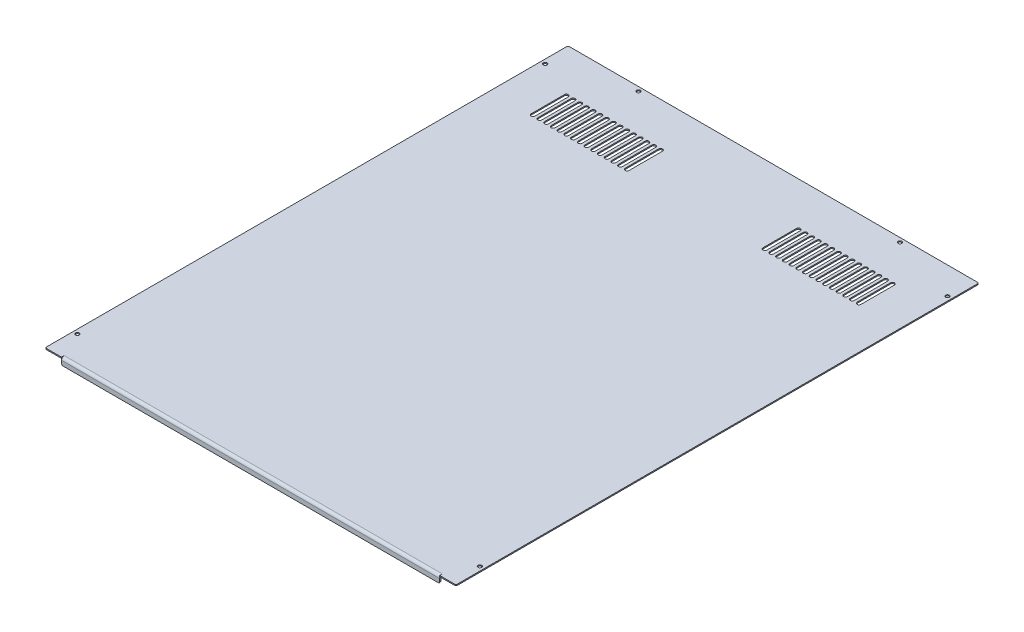
from build123d import *

# Parameters (mm, degrees)
SKETCH1_W                    = 220
SKETCH1_H                    = 560
BASE_FLANGE1_DEPTH           = 1.2
EDGE_FLANGE1_STRIP_W         = 8.2
EDGE_FLANGE1_STRIP_H         = 1.2
EDGE_FLANGE1_STRIP_CUT_DEPTH = 202.5
EDGE_FLANGE1_DEPTH           = 202.5
FILLET1_R                    = 1.5
SKETCH6_R                    = 2
CUT_EXTRUDE1_DEPTH           = 10
CUT_EXTRUDE2_DEPTH           = 10
LPATTERN1_COUNT              = 15
LPATTERN1_PITCH              = 7.2
FILLET2_R                    = 1.5


# Sheet-metal steps are written as plain solids
with BuildPart() as part:
    # Sketch1 → Base-Flange1 (new body)
    with BuildSketch(Plane(origin=(0, 0, 0), x_dir=(1, 0, 0), z_dir=(0, 1, 0))):
        with Locations((110, 280)):
            Rectangle(SKETCH1_W, SKETCH1_H)
    extrude(amount=BASE_FLANGE1_DEPTH)

    # Edge-Flange1 strip (across the edge) → Edge-Flange1 strip cut (cut)
    with BuildSketch(Plane(origin=(202.5, 0, 0), x_dir=(0, 0, -1), z_dir=(-1, 0, 0))):
        with Locations((-1.2, -0.6)):
            Rectangle(EDGE_FLANGE1_STRIP_W, EDGE_FLANGE1_STRIP_H)
    extrude(amount=EDGE_FLANGE1_STRIP_CUT_DEPTH, mode=Mode.SUBTRACT)

    # Edge-Flange1 section (across the edge) → Edge-Flange1 (add)
    with BuildSketch(Plane(origin=(202.5, 0, 0), x_dir=(0, 0, -1), z_dir=(-1, 0, 0))):
        with BuildLine():
            Line((0, 1.7), (0, 6.3))
            Line((0, 6.3), (1.2, 6.3))
            Line((1.2, 6.3), (1.2, 1.7))
            ThreePointArc((1.2, 1.7), (1.697918472, 0.497918472), (2.9, 0))
            Line((2.9, 0), (2.9, -1.2))
            ThreePointArc((2.9, -1.2), (0.849390335, -0.350609665), (0, 1.7))
        make_face()
    extrude(amount=EDGE_FLANGE1_DEPTH)

    # Fillet1
    fillet1_edges = [part.edges().sort_by_distance(p)[0] for p in [
        (202.5, -6.3, -0.6),
    ]]
    fillet(fillet1_edges, radius=FILLET1_R)

    # Sketch6 → Cut-Extrude1 (cut)
    with BuildSketch(Plane(origin=(0, 1.2, 0), x_dir=(1, 0, 0), z_dir=(0, 1, 0))):
        with Locations(Location((215.5, 531, 0), (0, 0, 270))):
            Circle(SKETCH6_R)
        with Locations(Location((215.5, 30, 0), (0, 0, 270))):
            Circle(SKETCH6_R)
        with Locations(Location((140, 555.5, 0), (0, 0, 270))):
            Circle(SKETCH6_R)
    extrude(amount=-CUT_EXTRUDE1_DEPTH, mode=Mode.SUBTRACT)

    # Sketch7 → Cut-Extrude2 (cut)
    with BuildSketch(Plane(origin=(0, 1.2, 0), x_dir=(1, 0, 0), z_dir=(0, 1, 0))):
        with BuildLine():
            Line((172.5, 477.1), (172.5, 512.9))
            ThreePointArc((172.5, 512.9), (174.6, 515), (176.7, 512.9))
            Line((176.7, 512.9), (176.7, 477.1))
            ThreePointArc((176.7, 477.1), (174.6, 475), (172.5, 477.1))
        make_face()
    cut_extrude2 = extrude(amount=-CUT_EXTRUDE2_DEPTH, mode=Mode.SUBTRACT)

    # LPattern1: Cut-Extrude2 ×15
    with Locations(*[(-i * LPATTERN1_PITCH, 0, 0) for i in range(1, LPATTERN1_COUNT)]):
        add(cut_extrude2, mode=Mode.SUBTRACT)

    # Fillet2
    fillet2_edges = [part.edges().sort_by_distance(p)[0] for p in [
        (220, 0.6, -560),
        (220, 0.6, 0),
    ]]
    fillet(fillet2_edges, radius=FILLET2_R)

    # Mirror1: part across plane


with BuildPart() as part_1:
    add(part.part)
    add(part.part.mirror(Plane(origin=(0, 1.2, 0), x_dir=(0, 0, 1), z_dir=(1, 0, 0))))


solid = part_1.part
